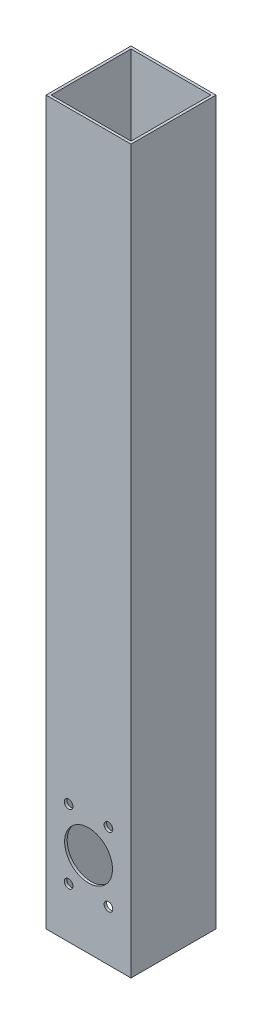
from build123d import *

# Parameters (mm, degrees)
SKETCH1_W               = 50.8
SKETCH1_H               = 50.8
SKETCH1_W_2             = 47.752
SKETCH1_H_2             = 47.752
EXTRUDE_THIN1_DEPTH     = 431.8
CUT_EXTRUDE1_DEPTH      = 434.291541574
CUT_EXTRUDE1_DEPTH_BACK = 434.291541574
SKETCH2_R               = 14.3002
SKETCH2_R_2             = 2.5908


with BuildPart() as part:
    # Sketch1 → Extrude-Thin1 (new body)
    with BuildSketch(Plane(origin=(0, 0, 0), x_dir=(1, 0, 0), z_dir=(0, 1, 0))):
        Rectangle(SKETCH1_W, SKETCH1_H)
        Rectangle(SKETCH1_W_2, SKETCH1_H_2, mode=Mode.SUBTRACT)
    extrude(amount=EXTRUDE_THIN1_DEPTH)

    # Sketch2 → Cut-Extrude1 (cut, two sides: drawn at the far end of the back side and taken through both)
    with BuildSketch(Plane.XY.offset(-CUT_EXTRUDE1_DEPTH_BACK)):
        with Locations((0, 50.8)):
            Circle(SKETCH2_R)
        with Locations((-11.90625, 30.177770072)):
            Circle(SKETCH2_R_2)
        with Locations((11.90625, 30.177770072)):
            Circle(SKETCH2_R_2)
        with Locations((11.90625, 71.422229928)):
            Circle(SKETCH2_R_2)
        with Locations((-11.90625, 71.422229928)):
            Circle(SKETCH2_R_2)
    extrude(amount=CUT_EXTRUDE1_DEPTH + CUT_EXTRUDE1_DEPTH_BACK, mode=Mode.SUBTRACT)


solid = part.part
